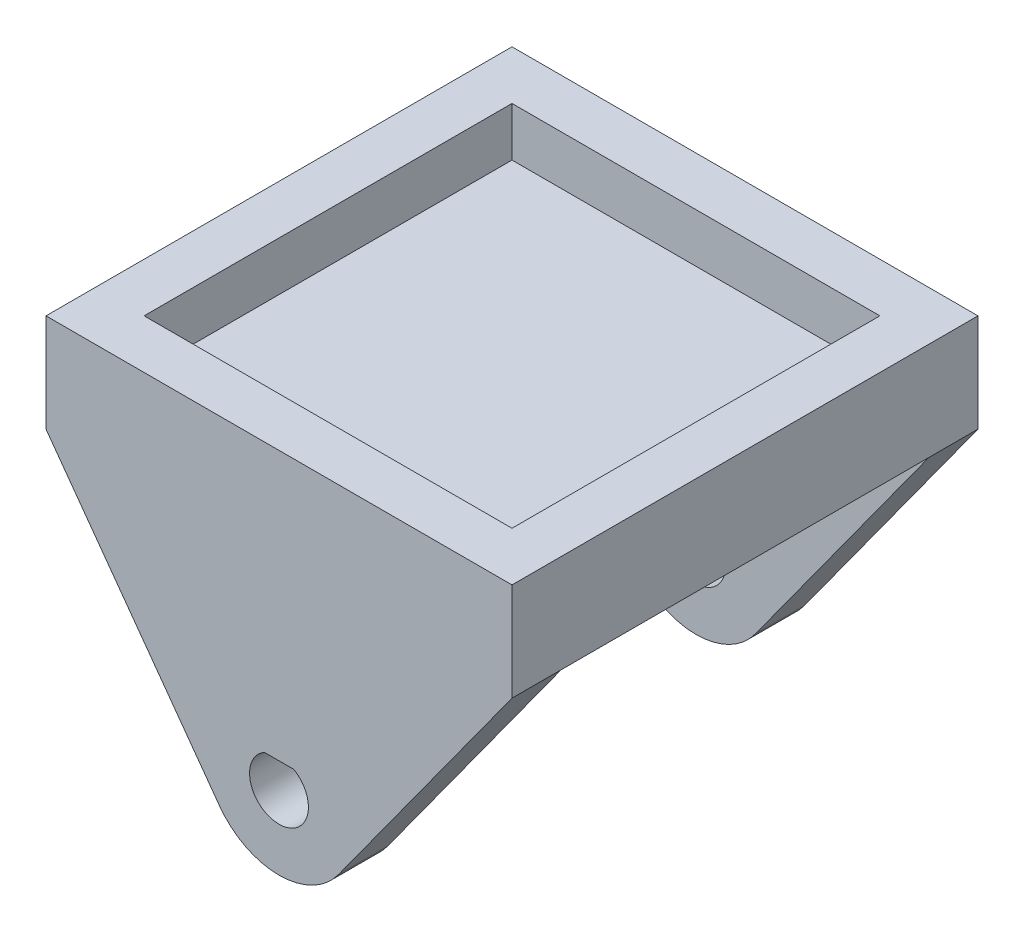
from build123d import *

# Parameters (mm, degrees)
BOSS_EXTRUDE1_DEPTH = 10
SKETCH1_3_W         = 95
SKETCH1_3_H         = 20
BOSS_EXTRUDE2_DEPTH = 95
SKETCH8_W           = 75
SKETCH8_H           = 75
CUT_EXTRUDE2_DEPTH  = 10


with BuildPart() as part:
    # Sketch1 → Boss-Extrude1 (new body)
    with BuildSketch(Plane.XY):
        with BuildLine():
            ThreePointArc((-12.147400293, -8.800037848), (0, -15), (12.147400293, -8.800037848))
            Line((12.147400293, -8.800037848), (47.5, 40))
            Line((47.5, 40), (-47.5, 40))
            Line((-47.5, 40), (-12.147400293, -8.800037848))
        make_face()
        with BuildLine():
            Line((-3, 5.196152423), (3, 5.196152423))
            ThreePointArc((3, 5.196152423), (0, -6), (-3, 5.196152423))
        make_face(mode=Mode.SUBTRACT)
    boss_extrude1 = extrude(amount=-BOSS_EXTRUDE1_DEPTH)

    # Sketch1<3> → Boss-Extrude2 (add)
    with BuildSketch(Plane.XY):
        with Locations((0, 50)):
            Rectangle(SKETCH1_3_W, SKETCH1_3_H)
    extrude(amount=-BOSS_EXTRUDE2_DEPTH)

    # Mirror2: Boss-Extrude1 across plane
    add(boss_extrude1.mirror(Plane.XY.offset(-47.5)))

    # Sketch8 → Cut-Extrude2 (cut)
    with BuildSketch(Plane(origin=(0, 60, 0), x_dir=(1, 0, 0), z_dir=(0, 1, 0))):
        with Locations((0, 47.5)):
            Rectangle(SKETCH8_W, SKETCH8_H)
    extrude(amount=-CUT_EXTRUDE2_DEPTH, mode=Mode.SUBTRACT)


solid = part.part
